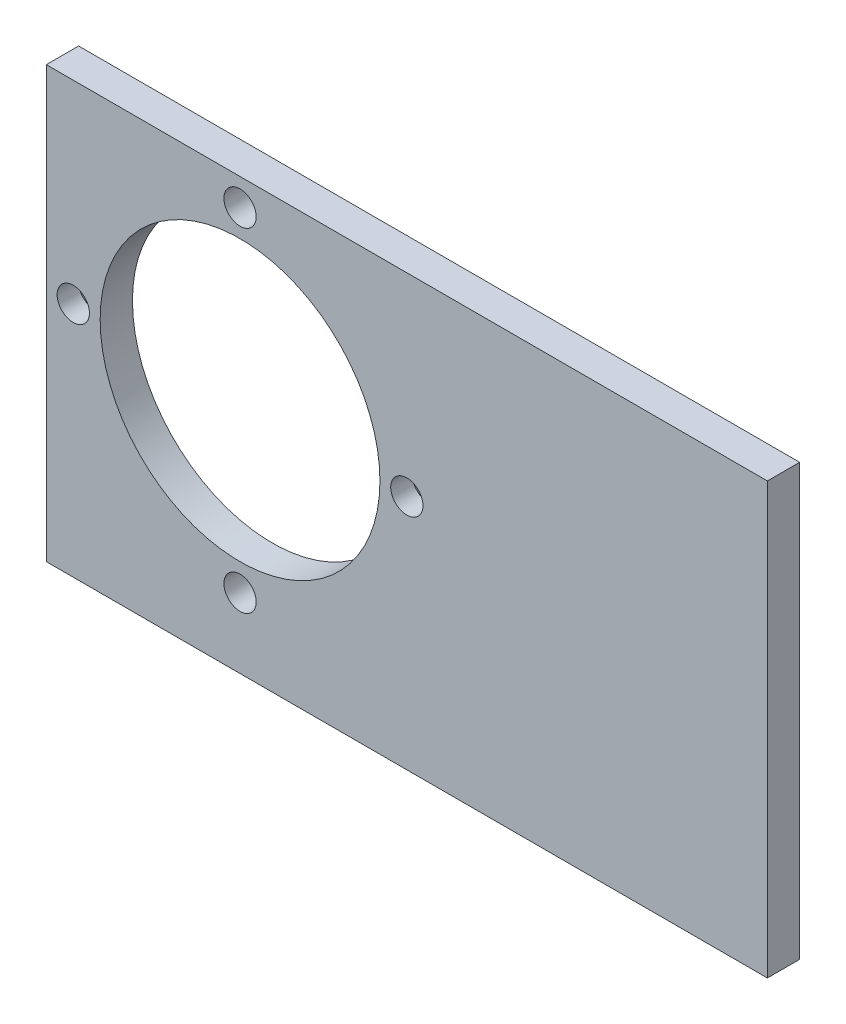
from build123d import *

# Parameters (mm, degrees)
SKETCH1_W           = 67
SKETCH1_H           = 40
SKETCH1_R           = 13
SKETCH1_R_2         = 1.5
BOSS_EXTRUDE1_DEPTH = 3
CHAMFER1_SIZE       = 1


with BuildPart() as part:
    # Sketch1 → Boss-Extrude1 (new body)
    with BuildSketch(Plane.XY):
        with Locations((70.4, 127.33)):
            Rectangle(SKETCH1_W, SKETCH1_H)
        with Locations((54.9, 129.33)):
            Circle(SKETCH1_R, mode=Mode.SUBTRACT)
        with Locations((39.4, 129.33)):
            Circle(SKETCH1_R_2, mode=Mode.SUBTRACT)
        with Locations((54.9, 144.83)):
            Circle(SKETCH1_R_2, mode=Mode.SUBTRACT)
        with Locations((70.4, 129.33)):
            Circle(SKETCH1_R_2, mode=Mode.SUBTRACT)
        with Locations((54.9, 113.83)):
            Circle(SKETCH1_R_2, mode=Mode.SUBTRACT)
    extrude(amount=BOSS_EXTRUDE1_DEPTH)

    # Chamfer1
    chamfer1_edges = [part.edges().sort_by_distance(p)[0] for p in [
        (37.9, 129.33, 0),
        (68.9, 129.33, 0),
    ]]
    chamfer(chamfer1_edges, length=CHAMFER1_SIZE - 0.0001)  # a hair under: the kernel refuses the full size


solid = part.part
